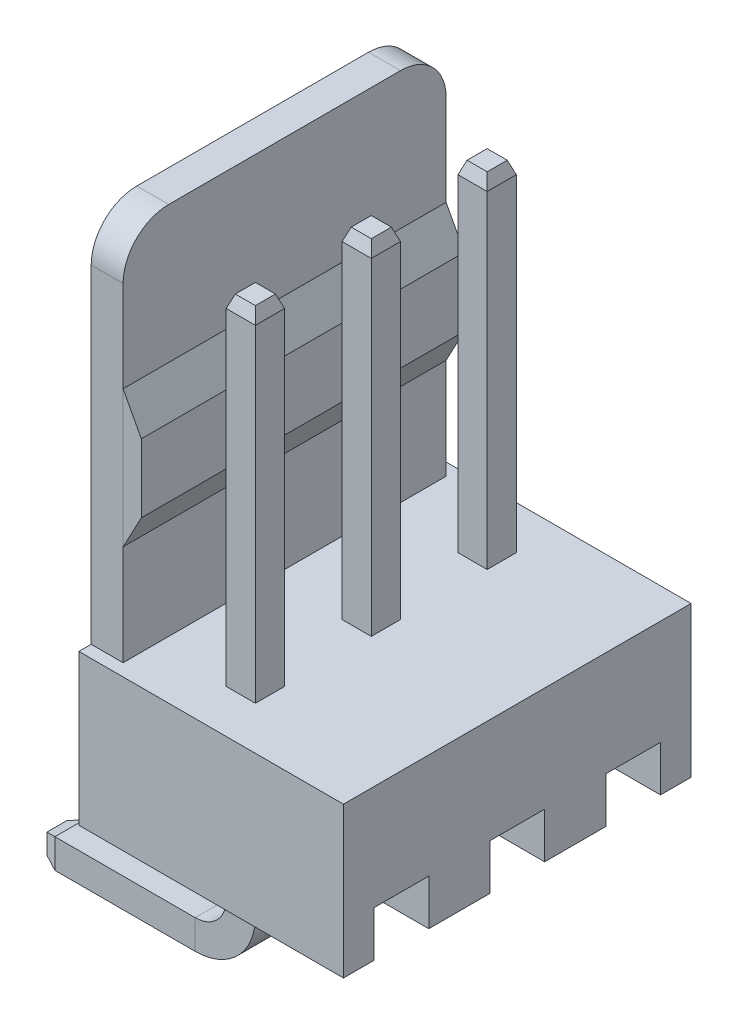
from build123d import *

# Parameters (mm, degrees)
SKETCH_1_W             = 0.64
SKETCH_1_H             = 0.64
CHAMFER_1_SIZE         = 0.1
CHAMFER_1_SIZE2        = 0.274747742
CHAMFER_2_SIZE         = 0.1
CHAMFER_2_SIZE2        = 0.274747742
PATTERN_LINEAR_3_COUNT = 2
PATTERN_LINEAR_3_PITCH = 2.54
EXTRUDE_1_DEPTH        = 5.8
EXTRUDE_2_DEPTH        = 0.7
EXTRUDE_3_DEPTH        = 7.08


with BuildPart() as part:
    # По траектории1: sweep along a curve in space
    with BuildLine() as sweep_1_path:
        Line((0, 0, 0), (-1.75, 0, 0))
        Line((0, 0, 0), (1.6, 0, 0))
        ThreePointArc((1.6, 0, 0), (2.307106781, 0.292893219, 0), (2.6, 1, 0))
        Line((2.6, 1, 0), (2.6, 12.5, 0))
    # Эскиз1 → По траектории1 (sweep)
    with BuildSketch(Plane(origin=(0, 0, 0), x_dir=(0, 0, -1), z_dir=(1, 0, 0))):
        Rectangle(SKETCH_1_W, SKETCH_1_H)
    sweep(path=sweep_1_path.line)

    # Фаска1
    chamfer_1_edges = [part.edges().sort_by_distance(p)[0] for p in [
        (2.92, 12.5, 0),
        (2.6, 12.5, -0.32),
        (2.28, 12.5, 0),
        (2.6, 12.5, 0.32),
    ]]
    chamfer_1_side = [part.faces().sort_by_distance(p)[0] for p in [
        (2.6, 12.5, 0),
    ]]
    chamfer(chamfer_1_edges, length=CHAMFER_1_SIZE, length2=CHAMFER_1_SIZE2, reference=chamfer_1_side[0])

    # Фаска2
    chamfer_2_edges = [part.edges().sort_by_distance(p)[0] for p in [
        (-1.75, 0, 0.32),
        (-1.75, -0.32, 0),
        (-1.75, 0, -0.32),
        (-1.75, 0.32, 0),
    ]]
    chamfer_2_side = [part.faces().sort_by_distance(p)[0] for p in [
        (-1.75, 0, 0),
    ]]
    chamfer(chamfer_2_edges, length=CHAMFER_2_SIZE, length2=CHAMFER_2_SIZE2, reference=chamfer_2_side[0])


with BuildPart() as body_2:
    # Линейный массив2: read off the stored shape, not the designer's step
    # Линейный массив2: copy of part
    add(part.part.moved(Location((0, 0, -2.54))))


with BuildPart() as pattern_linear_3_1:
    # Линейный массив3: pattern copy
    add(part.part.moved(Location(Vector(0, 0, 1) * (1 * PATTERN_LINEAR_3_PITCH))))


with BuildPart() as body_4:
    # Эскиз2 → Бобышка-Вытянуть1 (new body)
    with BuildSketch(Plane(origin=(0, 0, 0), x_dir=(0, 0, -1), z_dir=(1, 0, 0))):
        Polygon((0.6, 2.75), (0.6, 1.75), (1.94, 1.75), (1.94, 2.75), (3.14, 2.75), (3.14, 1.75), (3.81, 1.75), (3.81, 5.05), (-3.81, 5.05), (-3.81, 1.75), (-3.14, 1.75), (-3.14, 2.75), (-1.94, 2.75), (-1.94, 1.75), (-0.6, 1.75), (-0.6, 2.75), align=None)
    extrude(amount=EXTRUDE_1_DEPTH)


with BuildPart() as body_5:
    # Эскиз3 → Бобышка-Вытянуть2 (new body)
    with BuildSketch(Plane.ZY):
        with BuildLine():
            Line((-3.54, 5.05), (3.54, 5.05))
            Line((3.54, 5.05), (3.54, 12.25))
            ThreePointArc((3.54, 12.25), (3.247106781, 12.957106781), (2.54, 13.25))
            Line((2.54, 13.25), (-2.54, 13.25))
            ThreePointArc((-2.54, 13.25), (-3.247106781, 12.957106781), (-3.54, 12.25))
            Line((-3.54, 12.25), (-3.54, 5.05))
        make_face()
    extrude(amount=-EXTRUDE_2_DEPTH)


with BuildPart() as body_6:
    # Эскиз4 → Бобышка-Вытянуть3 (new body)
    with BuildSketch(Plane(origin=(0, 0, -3.54), x_dir=(-1, 0, 0), z_dir=(0, 0, -1))):
        Polygon((-0.7, 7.251063618), (-1.1, 8.001063618), (-1.1, 9.501063618), (-0.7, 10.251063618), align=None)
    extrude(amount=-EXTRUDE_3_DEPTH)


solid = Compound([part.part, body_2.part, pattern_linear_3_1.part, body_4.part, body_5.part, body_6.part])
